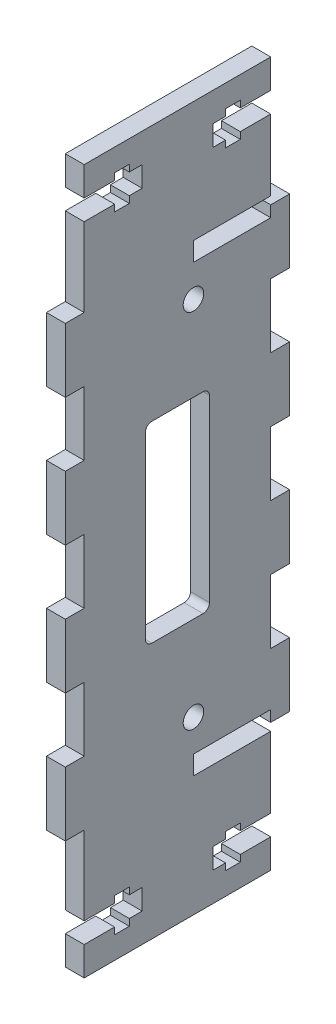
from build123d import *

# Parameters (mm, degrees)
FRONT_START          = -3.366352234
FRONT_PLATE_DEPTH    = 2.95
CUT_EXTRUDE1_START   = 2.95
SKETCH1_W            = 3.2
SKETCH1_H            = 3.2
CUT_EXTRUDE1_DEPTH   = 12
SKETCH2_W            = 2.3
SKETCH2_H            = 5.3
CUT_EXTRUDE2_DEPTH   = 97.656428996
M3_CLEARANCE_HOLE1_D = 3.2
SKETCH5_W            = 10
SKETCH5_H            = 30
CUT_EXTRUDE3_DEPTH   = 97.656428996
FILLET1_R            = 1


# Read off the part's stored shape, not the designer's step: Front Plate
with BuildPart() as part:
    # Front Plate outline → Front Plate (new body)
    with BuildSketch(Plane.YZ.offset(FRONT_START)):
        Polygon((-23.21888173, 23.452809495), (-12.14788173, 23.452809495), (-12.14788173, 35.517809495), (-9.19788173, 35.517809495), (-9.19788173, 23.452809495), (-10.94388173, 23.452809495), (-10.94388173, 20.502809495), (-0.94388173, 20.502809495), (-0.94388173, 23.452809495), (9.05611827, 23.452809495), (9.05611827, 20.502809495), (19.05611827, 20.502809495), (19.05611827, 23.452809495), (29.05611827, 23.452809495), (29.05611827, 20.502809495), (39.05611827, 20.502809495), (39.05611827, 23.452809495), (49.05611827, 23.452809495), (49.05611827, 20.502809495), (59.05611827, 20.502809495), (59.05611827, 23.452809495), (57.31011827, 23.452809495), (57.31011827, 35.517809495), (60.26011827, 35.517809495), (60.26011827, 23.452809495), (71.33111827, 23.452809495), (71.33111827, 28.202809495), (70.28111827, 28.202809495), (70.28111827, 30.502809495), (71.33111827, 30.502809495), (71.33111827, 32.502809495), (74.53111827, 32.502809495), (74.53111827, 30.502809495), (75.58111827, 30.502809495), (75.58111827, 28.202809495), (74.53111827, 28.202809495), (74.53111827, 23.452809495), (79.05611827, 23.452809495), (79.05611827, 52.582809495), (59.05611827, 52.582809495), (59.05611827, 55.532809495), (49.05611827, 55.532809495), (49.05611827, 52.582809495), (39.05611827, 52.582809495), (39.05611827, 55.532809495), (29.05611827, 55.532809495), (29.05611827, 52.582809495), (19.05611827, 52.582809495), (19.05611827, 55.532809495), (9.05611827, 55.532809495), (9.05611827, 52.582809495), (-0.94388173, 52.582809495), (-0.94388173, 55.532809495), (-10.94388173, 55.532809495), (-10.94388173, 52.582809495), (-30.94388173, 52.582809495), (-30.94388173, 23.452809495), (-26.41888173, 23.452809495), (-26.41888173, 28.202809495), (-27.46888173, 28.202809495), (-27.46888173, 30.502809495), (-26.41888173, 30.502809495), (-26.41888173, 32.502809495), (-23.21888173, 32.502809495), (-23.21888173, 30.502809495), (-22.16888173, 30.502809495), (-22.16888173, 28.202809495), (-23.21888173, 28.202809495), align=None)
    extrude(amount=FRONT_PLATE_DEPTH)

    # Sketch1 → Cut-Extrude1 (cut)
    with BuildSketch(Plane.XY.offset(52.582809495).offset(CUT_EXTRUDE1_START)):
        with Locations((-1.891352234, 72.93111827)):
            Rectangle(SKETCH1_W, SKETCH1_H)
    cut_extrude1 = extrude(amount=-CUT_EXTRUDE1_DEPTH, mode=Mode.SUBTRACT)

    # Sketch2 → Cut-Extrude2 (cut, through all)
    with BuildSketch(Plane.ZY.offset(3.366352234)):
        with Locations((46.682809496, 72.93111827)):
            Rectangle(SKETCH2_W, SKETCH2_H)
    cut_extrude2 = extrude(amount=-CUT_EXTRUDE2_DEPTH, mode=Mode.SUBTRACT)

    # M3 Clearance Hole1 (through all)
    with Locations(Plane(origin=(-0.416352234, 0, 0), x_dir=(0, 0, -1), z_dir=(1, 0, 0))):
        with Locations((-35.517809495, 52.31011827)):
            m3_clearance_hole1 = Hole(M3_CLEARANCE_HOLE1_D / 2)

    # Mirror1: Cut-Extrude1, Cut-Extrude2, M3 Clearance Hole1 across plane
    add(cut_extrude1.mirror(Plane.ZX.offset(24.05611827)), mode=Mode.SUBTRACT)
    add(cut_extrude2.mirror(Plane.ZX.offset(24.05611827)), mode=Mode.SUBTRACT)
    add(m3_clearance_hole1.mirror(Plane.ZX.offset(24.05611827)), mode=Mode.SUBTRACT)

    # Sketch5 → Cut-Extrude3 (cut, through all)
    with BuildSketch(Plane(origin=(-0.416352234, 0, 0), x_dir=(0, 0, -1), z_dir=(1, 0, 0))):
        with Locations((-38.017809495, 24.05611827)):
            Rectangle(SKETCH5_W, SKETCH5_H)
    extrude(amount=-CUT_EXTRUDE3_DEPTH, mode=Mode.SUBTRACT)

    # Fillet1
    fillet1_edges = [part.edges().sort_by_distance(p)[0] for p in [
        (-1.891352234, 39.05611827, 33.017809495),
        (-1.891352234, 9.05611827, 33.017809495),
        (-1.891352234, 9.05611827, 43.017809495),
        (-1.891352234, 39.05611827, 43.017809495),
    ]]
    fillet(fillet1_edges, radius=FILLET1_R)


solid = part.part
